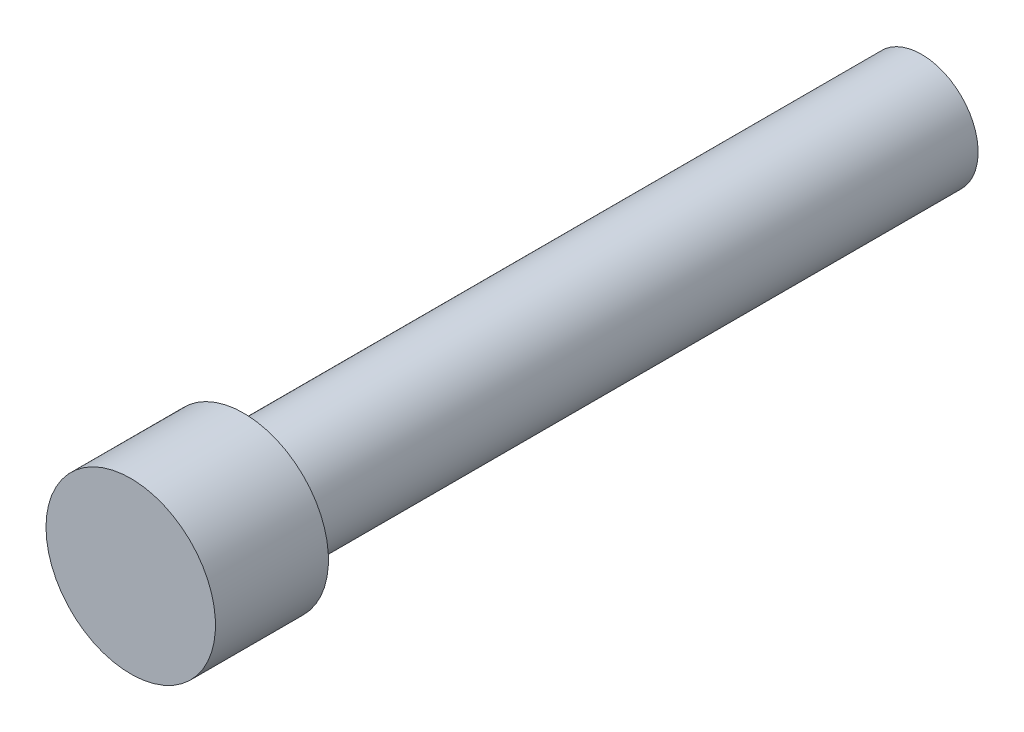
from build123d import *


with BuildPart() as part:
    # Sketch2 → Revolve1 (revolve)
    with BuildSketch(Plane(origin=(0, 0, 0), x_dir=(0, 0, -1), z_dir=(1, 0, 0))):
        Polygon((22.225, 0), (22.225, 3.175), (-15.875, 3.175), (-15.875, 4.7625), (-22.225, 4.7625), (-22.225, 0), align=None)
    revolve(axis=Axis((0, 0, -22.225), (0, 0, 1)))


solid = part.part
